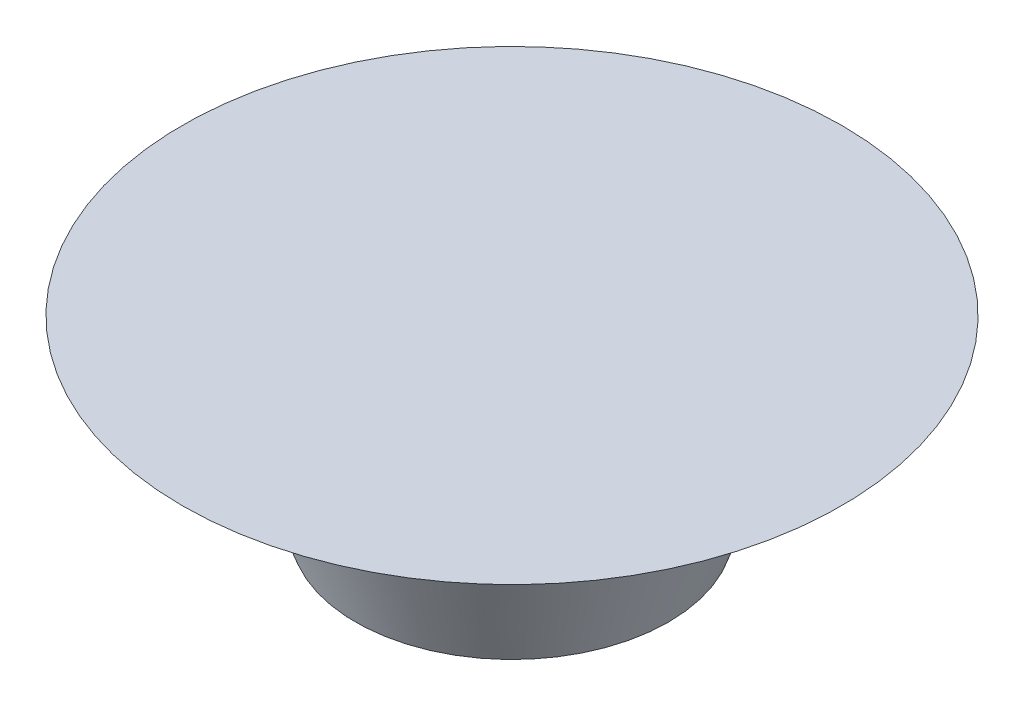
from build123d import *

# Parameters (mm, degrees)
SKETCH1_W          = 50
SKETCH1_H          = 1
BASE_EXTRUDE_DEPTH = 25
FILLET1_R          = 4
SKETCH3_W          = 50
SKETCH3_H          = 1
CUT_EXTRUDE1_DEPTH = 57.124860802


with BuildPart() as part:
    # Sketch1 → Base-Extrude (new, symmetric)
    with BuildSketch(Plane.XY):
        with Locations((0, 0.5)):
            Rectangle(SKETCH1_W, SKETCH1_H)
    extrude(amount=BASE_EXTRUDE_DEPTH, both=True)

    # Sketch2 → Boss-Revolve1 (revolve)
    with BuildSketch(Plane.XY):
        Polygon((6, 0), (4.180148829, -5), (0, -5), (0, 0), align=None)
    revolve(axis=Axis((0, 5.617399157, 0), (0, -1, 0)))

    # Fillet1
    fillet1_edges = [part.edges().sort_by_distance(p)[0] for p in [
        (-6, 0, 0),
    ]]
    fillet(fillet1_edges, radius=FILLET1_R)

    # Sketch3 → Cut-Extrude1 (cut, through all)
    with BuildSketch(Plane(origin=(25, 0, 0), x_dir=(0, 0, -1), z_dir=(1, 0, 0))):
        with Locations((0, 0.5)):
            Rectangle(SKETCH3_W, SKETCH3_H)
    extrude(amount=-CUT_EXTRUDE1_DEPTH, mode=Mode.SUBTRACT)


solid = part.part
